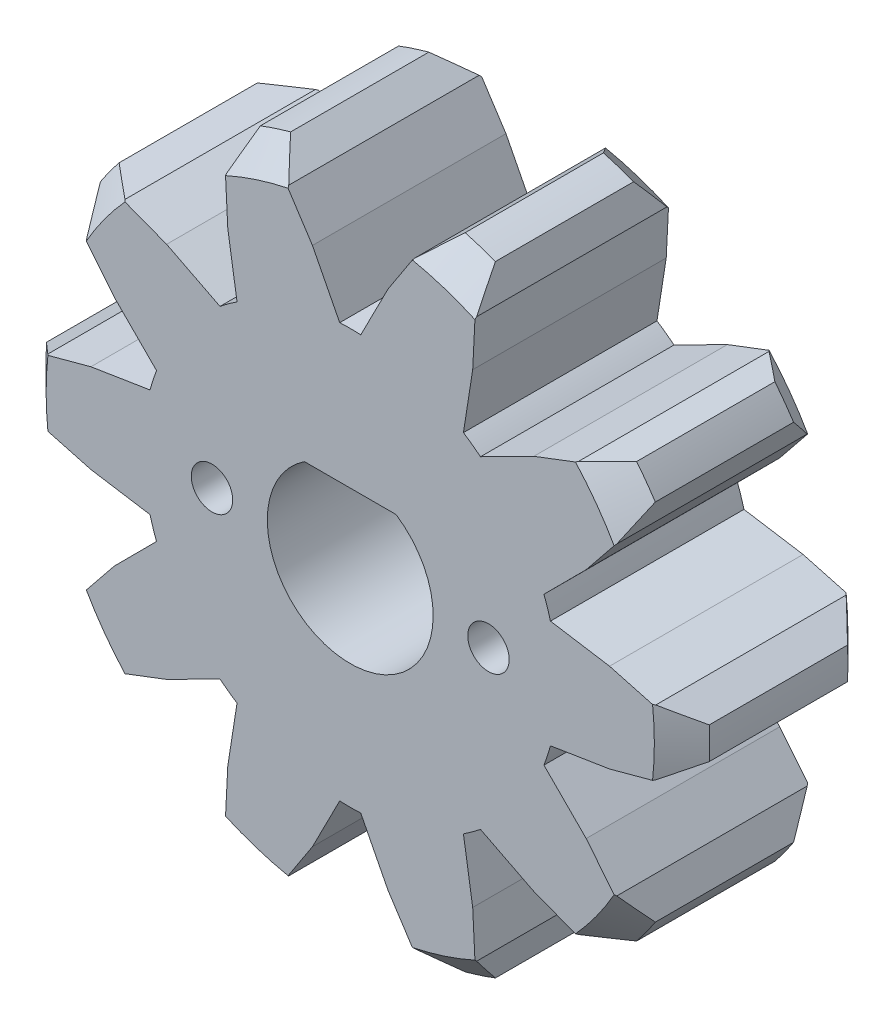
from build123d import *

# Parameters (mm, degrees)
SKETCH_1_R               = 12
EXTRUDE_1_DEPTH          = 7
CHAMFER_1_SIZE           = 1
CUT_EXTRUDE_1_DEPTH      = 19.357559751
PATTERN_CIRCULAR_1_COUNT = 10
SKETCH_4_R               = 0.75
CUT_EXTRUDE_2_DEPTH      = 19.084116167


with BuildPart() as part:
    # 草图1 → 凸台-拉伸1 (new body)
    with BuildSketch(Plane.XY):
        Circle(SKETCH_1_R)
    extrude(amount=EXTRUDE_1_DEPTH)

    # 倒角1
    chamfer_1_edges = [part.edges().sort_by_distance(p)[0] for p in [
        (-12, 0, 0),
        (-12, 0, 7),
    ]]
    chamfer(chamfer_1_edges, length=CHAMFER_1_SIZE)

    # 草图2 → 切除-拉伸1 (cut, through all)
    with BuildSketch(Plane.XY):
        with BuildLine():
            Line((53.359492076, 55.093512693), (3.255057309, 11.662618245))
            Line((3.255057309, 11.662618245), (3.187549193, 11.604101711))
            Line((3.187549193, 11.604101711), (2.28130287, 10.818560699))
            Line((2.28130287, 10.818560699), (1.367192566, 9.417725064))
            Line((1.367192566, 9.417725064), (0.380916531, 7.490320594))
            ThreePointArc((0.380916531, 7.490320594), (0, 7.5), (-0.380916531, 7.490320594))
            Line((-0.380916531, 7.490320594), (-1.367192566, 9.417725064))
            Line((-1.367192566, 9.417725064), (-2.28130287, 10.818560699))
            Line((-2.28130287, 10.818560699), (-3.187549193, 11.604101711))
            Line((-3.187549193, 11.604101711), (-3.255057309, 11.662618245))
            Line((-3.255057309, 11.662618245), (-53.359492076, 55.093512693))
            Line((-53.359492076, 55.093512693), (-53.359492076, 187.708699996))
            Line((-53.359492076, 187.708699996), (53.359492076, 187.708699996))
            Line((53.359492076, 187.708699996), (53.359492076, 55.093512693))
        make_face()
    cut_extrude_1 = extrude(amount=CUT_EXTRUDE_1_DEPTH, mode=Mode.SUBTRACT)

    # 阵列(圆周)1: 切除-拉伸1 ×10 about axis
    pattern_circular_1_axis = Axis((0, 0, -1.5), (0, 0, 1))
    for i in range(1, PATTERN_CIRCULAR_1_COUNT):
        add(cut_extrude_1.rotate(pattern_circular_1_axis, i * 360 / PATTERN_CIRCULAR_1_COUNT), mode=Mode.SUBTRACT)

    # 草图4 → 切除-拉伸2 (cut, through all)
    with BuildSketch(Plane.XY):
        with Locations((5, 0)):
            Circle(SKETCH_4_R)
        with Locations((-5, 0)):
            Circle(SKETCH_4_R)
        with BuildLine():
            Line((-0.9, 2.5), (0.9, 2.5))
            Line((0.9, 2.5), (1.658312395, 2.5))
            ThreePointArc((1.658312395, 2.5), (0, -3), (-1.658312395, 2.5))
            Line((-1.658312395, 2.5), (-0.9, 2.5))
        make_face()
    extrude(amount=CUT_EXTRUDE_2_DEPTH, mode=Mode.SUBTRACT)


solid = part.part
